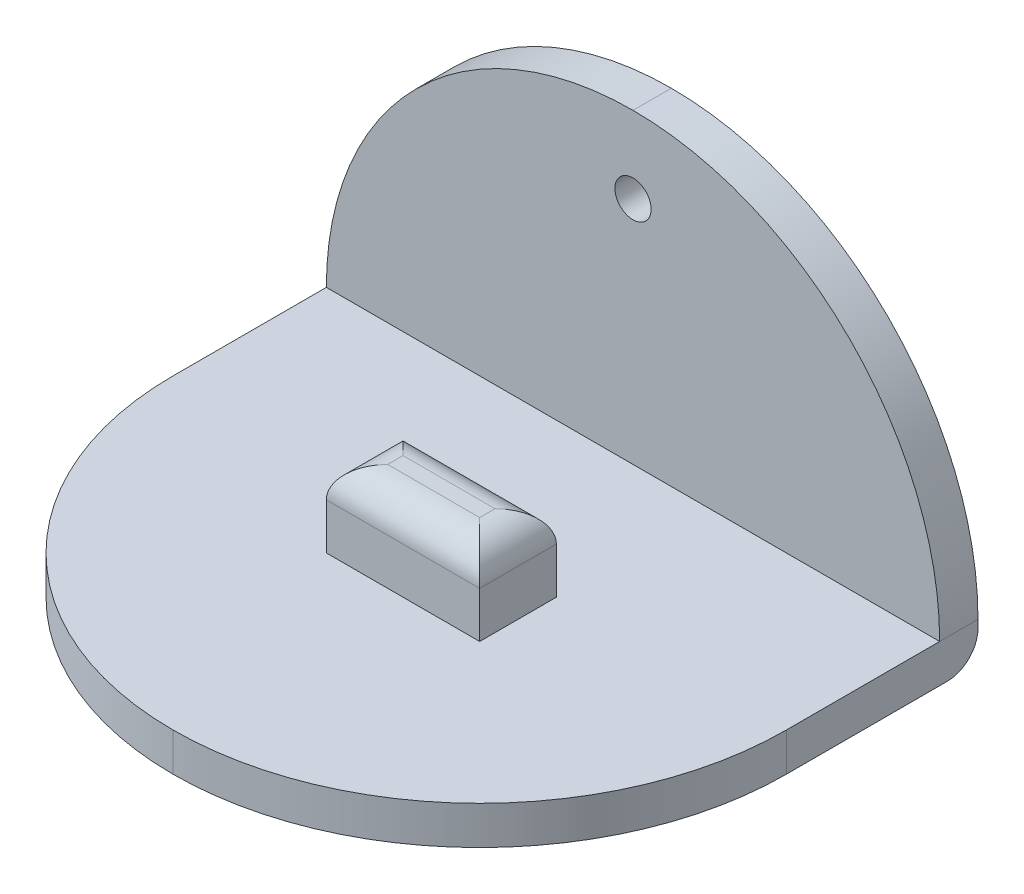
from build123d import *

# Parameters (mm, degrees)
BOSS_EXTRUDE1_DEPTH = 50.8
SKETCH2_W           = 12.7
SKETCH2_H           = 6.35
BOSS_EXTRUDE2_DEPTH = 6.35
SKETCH3_R           = 1.499997
CUT_EXTRUDE1_DEPTH  = 70.633186233
FILLET1_R           = 2.54
FILLET2_R           = 25.4
FILLET3_R           = 2.54


with BuildPart() as part:
    # Sketch1 → Boss-Extrude1 (new body)
    with BuildSketch(Plane(origin=(0, 0, 0), x_dir=(0, 0, -1), z_dir=(1, 0, 0))):
        Polygon((0, 0), (-41.275, 0), (-41.275, 3.175), (-3.175, 3.175), (-3.175, 28.575), (0, 28.575), align=None)
    extrude(amount=BOSS_EXTRUDE1_DEPTH)

    # Sketch2 → Boss-Extrude2 (add)
    with BuildSketch(Plane(origin=(0, 3.175, 0), x_dir=(1, 0, 0), z_dir=(0, 1, 0))):
        with Locations((25.4, -19.05)):
            Rectangle(SKETCH2_W, SKETCH2_H)
    extrude(amount=BOSS_EXTRUDE2_DEPTH)

    # Sketch3 → Cut-Extrude1 (cut, through all)
    with BuildSketch(Plane.XY.offset(3.175)):
        with Locations((25.4, 22.225)):
            Circle(SKETCH3_R)
    extrude(amount=-CUT_EXTRUDE1_DEPTH, mode=Mode.SUBTRACT)

    # Fillet1
    fillet1_edges = [part.edges().sort_by_distance(p)[0] for p in [
        (19.05, 9.525, 19.05),
        (25.4, 9.525, 22.225),
        (31.75, 9.525, 19.05),
        (25.4, 9.525, 15.875),
    ]]
    fillet(fillet1_edges, radius=FILLET1_R)

    # Fillet2
    fillet2_edges = [part.edges().sort_by_distance(p)[0] for p in [
        (0, 28.575, 1.5875),
        (50.8, 28.575, 1.5875),
        (50.8, 1.5875, 41.275),
        (0, 1.5875, 41.275),
    ]]
    fillet(fillet2_edges, radius=FILLET2_R - 0.0001)  # a hair under: the kernel refuses the full size

    # Fillet3
    fillet3_edges = [part.edges().sort_by_distance(p)[0] for p in [
        (25.4, 0, 0),
    ]]
    fillet(fillet3_edges, radius=FILLET3_R)


solid = part.part
